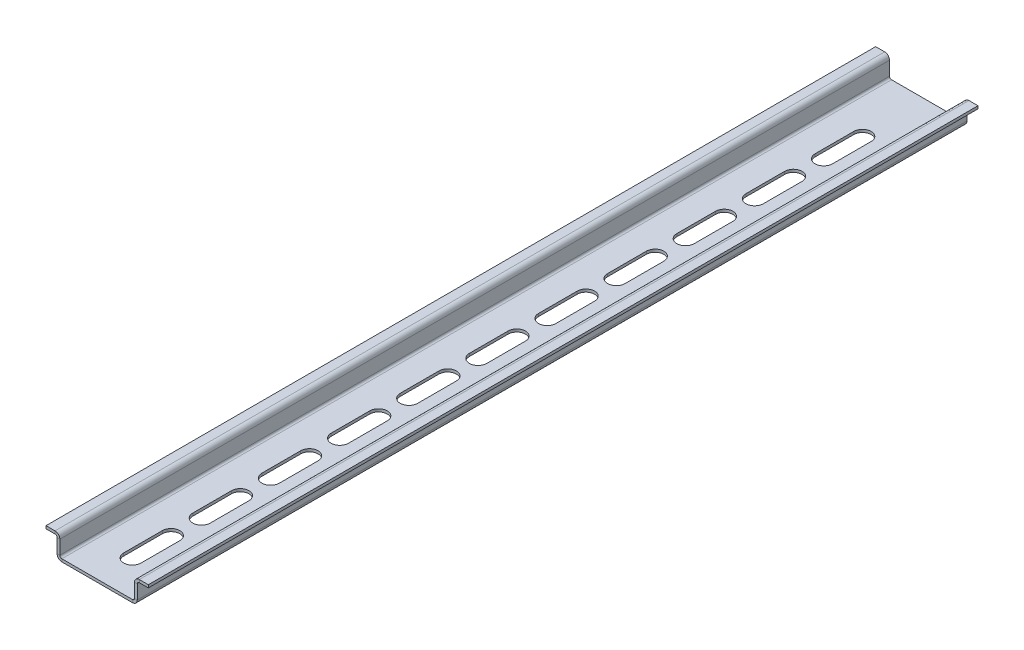
from build123d import *

# Parameters (mm, degrees)
BASE_FLANGE1_DEPTH = 300
CUT_EXTRUDE1_DEPTH = 10
LPATTERN1_COUNT    = 11
LPATTERN1_PITCH    = 25


# Sheet-metal steps are written as plain solids
with BuildPart() as part:
    # Sketch1 → Base-Flange1 (new body)
    with BuildSketch(Plane.XY):
        with BuildLine():
            Line((0, 0), (3.2634, 0))
            ThreePointArc((3.2634, 0), (4.491361636, -0.508638364), (5, -1.7366))
            Line((5, -1.7366), (5, -6.7634))
            ThreePointArc((5, -6.7634), (5.215745145, -7.284254855), (5.7366, -7.5))
            Line((5.7366, -7.5), (31.2634, -7.5))
            ThreePointArc((31.2634, -7.5), (31.784254855, -7.284254855), (32, -6.7634))
            Line((32, -6.7634), (32, -1.7366))
            ThreePointArc((32, -1.7366), (32.508638364, -0.508638364), (33.7366, 0))
            Line((33.7366, 0), (37, 0))
            Line((37, 0), (37, -1))
            Line((37, -1), (33.7366, -1))
            ThreePointArc((33.7366, -1), (33.215745145, -1.215745145), (33, -1.7366))
            Line((33, -1.7366), (33, -6.7634))
            ThreePointArc((33, -6.7634), (32.491361636, -7.991361636), (31.2634, -8.5))
            Line((31.2634, -8.5), (5.7366, -8.5))
            ThreePointArc((5.7366, -8.5), (4.508638364, -7.991361636), (4, -6.7634))
            Line((4, -6.7634), (4, -1.7366))
            ThreePointArc((4, -1.7366), (3.784254855, -1.215745145), (3.2634, -1))
            Line((3.2634, -1), (0, -1))
            Line((0, -1), (0, 0))
        make_face()
    extrude(amount=BASE_FLANGE1_DEPTH)

    # Sketch6 → Cut-Extrude1 (cut)
    with BuildSketch(Plane(origin=(0, -7.5, 0), x_dir=(1, 0, 0), z_dir=(0, 1, 0))):
        with BuildLine():
            Line((21.3866, -273), (21.3866, -287))
            ThreePointArc((21.3866, -287), (18.2366, -290.15), (15.0866, -287))
            Line((15.0866, -287), (15.0866, -273))
            ThreePointArc((15.0866, -273), (18.2366, -269.85), (21.3866, -273))
        make_face()
    cut_extrude1 = extrude(amount=-CUT_EXTRUDE1_DEPTH, mode=Mode.SUBTRACT)

    # LPattern1: Cut-Extrude1 ×11
    with Locations(*[(0, 0, -i * LPATTERN1_PITCH) for i in range(1, LPATTERN1_COUNT)]):
        add(cut_extrude1, mode=Mode.SUBTRACT)


solid = part.part
